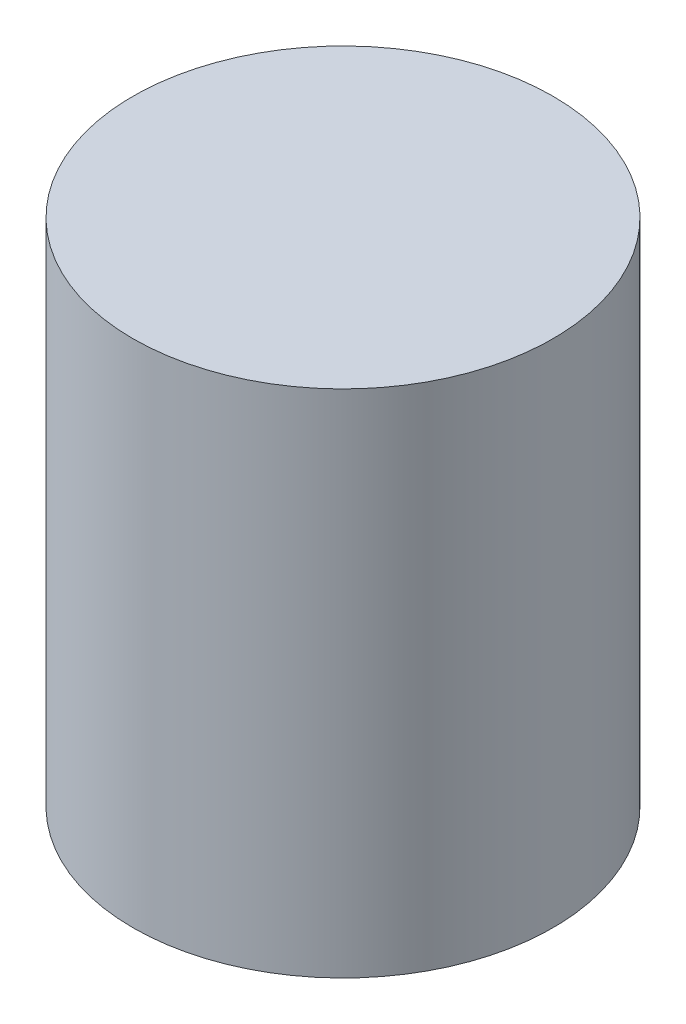
from build123d import *

# Parameters (mm, degrees)
BOSS_EXTRUDE1_DEPTH     = 15
BOSS_EXTRUDE2_START     = -30
BOSS_EXTRUDE2_OUTLINE_R = 37.05
BOSS_EXTRUDE2_DEPTH     = 90


# Read off the part's stored shape, not the designer's step: Boss-Extrude2
with BuildPart() as part:
    # Sketch1 → Boss-Extrude1 (new body)
    with BuildSketch(Plane(origin=(0, 0, 0), x_dir=(1, 0, 0), z_dir=(0, 1, 0))):
        with BuildLine():
            Line((-0.5, 37), (0.5, 37))
            Line((0.5, 37), (1.532639575, 35.967360425))
            ThreePointArc((1.532639575, 35.967360425), (1.687401449, 35.960432093), (1.842132075, 35.952837849))
            Line((1.842132075, 35.952837849), (2.966932122, 36.88424208))
            Line((2.966932122, 36.88424208), (3.962538104, 36.79060059))
            Line((3.962538104, 36.79060059), (4.893942334, 35.665800544))
            ThreePointArc((4.893942334, 35.665800544), (5.047375402, 35.644410523), (5.200715003, 35.622360442))
            Line((5.200715003, 35.622360442), (6.407790737, 36.444344114))
            Line((6.407790737, 36.444344114), (7.39025328, 36.257884059))
            Line((7.39025328, 36.257884059), (8.212236952, 35.050808325))
            ThreePointArc((8.212236952, 35.050808325), (8.362992839, 35.015144592), (8.513593861, 34.97883245))
            Line((8.513593861, 34.97883245), (9.792337458, 35.684171941))
            Line((9.792337458, 35.684171941), (10.753022645, 35.40653194))
            Line((10.753022645, 35.40653194), (11.458362136, 34.127788343))
            ThreePointArc((11.458362136, 34.127788343), (11.605115994, 34.07816431), (11.751654949, 34.027909221))
            Line((11.751654949, 34.027909221), (13.090828764, 34.610405982))
            Line((13.090828764, 34.610405982), (14.02129406, 34.244025944))
            Line((14.02129406, 34.244025944), (14.603790822, 32.904852129))
            ThreePointArc((14.603790822, 32.904852129), (14.745252972, 32.841703896), (14.886442071, 32.777947502))
            Line((14.886442071, 32.777947502), (16.274277397, 33.232482532))
            Line((16.274277397, 33.232482532), (17.166345839, 32.780582218))
            Line((17.166345839, 32.780582218), (17.620880869, 31.392746892))
            ThreePointArc((17.620880869, 31.392746892), (17.755808137, 31.316629407), (17.890406605, 31.239932002))
            Line((17.890406605, 31.239932002), (19.314707094, 31.562510829))
            Line((19.314707094, 31.562510829), (20.160539154, 31.029061556))
            Line((20.160539154, 31.029061556), (20.483117981, 29.604761066))
            ThreePointArc((20.483117981, 29.604761066), (20.610324622, 29.516343252), (20.737149602, 29.427378857))
            Line((20.737149602, 29.427378857), (22.185398452, 29.615166647))
            Line((22.185398452, 29.615166647), (22.977560925, 29.004856385))
            Line((22.977560925, 29.004856385), (23.165348716, 27.556607536))
            ThreePointArc((23.165348716, 27.556607536), (23.283716833, 27.456666412), (23.401653783, 27.356216847))
            Line((23.401653783, 27.356216847), (24.86112373, 27.407563316))
            Line((24.86112373, 27.407563316), (25.592655065, 26.725755494))
            Line((25.592655065, 26.725755494), (25.644001533, 25.266285548))
            ThreePointArc((25.644001533, 25.266285548), (25.752490903, 25.1556994), (25.860503389, 25.044647421))
            Line((25.860503389, 25.044647421), (27.318368558, 24.959101332))
            Line((27.318368558, 24.959101332), (27.982840032, 24.211787702))
            Line((27.982840032, 24.211787702), (27.897293943, 22.753922533))
            ThreePointArc((27.897293943, 22.753922533), (27.994951157, 22.633663197), (28.092089962, 22.512984732))
            Line((28.092089962, 22.512984732), (29.535538582, 22.291297869))
            Line((29.535538582, 22.291297869), (30.127110794, 21.48504585))
            Line((30.127110794, 21.48504585), (29.905423931, 20.04159723))
            ThreePointArc((29.905423931, 20.04159723), (29.991390774, 19.912721549), (30.076802238, 19.783477125))
            Line((30.076802238, 19.783477125), (31.493149231, 19.427597678))
            Line((31.493149231, 19.427597678), (32.006623424, 18.569492642))
            Line((32.006623424, 18.569492642), (31.650743977, 17.153145649))
            ThreePointArc((31.650743977, 17.153145649), (31.72426497, 17.016786187), (31.797198494, 16.880111609))
            Line((31.797198494, 16.880111609), (33.173996951, 16.39316706))
            Line((33.173996951, 16.39316706), (33.604860696, 15.490750065))
            Line((33.604860696, 15.490750065), (33.117916148, 14.113951608))
            ThreePointArc((33.117916148, 14.113951608), (33.178345185, 13.971306696), (33.238159827, 13.828403065))
            Line((33.238159827, 13.828403065), (34.563310394, 13.214672701))
            Line((34.563310394, 13.214672701), (34.907777244, 12.27587422))
            Line((34.907777244, 12.27587422), (34.294046881, 10.950723653))
            ThreePointArc((34.294046881, 10.950723653), (34.340852909, 10.80304686), (34.387023016, 10.655170017))
            Line((34.387023016, 10.655170017), (35.648880222, 9.920047323))
            Line((35.648880222, 9.920047323), (35.903922991, 8.95311755))
            Line((35.903922991, 8.95311755), (35.168800297, 7.691260344))
            ThreePointArc((35.168800297, 7.691260344), (35.201571984, 7.53984946), (35.23369181, 7.388298953))
            Line((35.23369181, 7.388298953), (36.421166409, 6.538244213))
            Line((36.421166409, 6.538244213), (36.584543771, 5.551680562))
            Line((36.584543771, 5.551680562), (35.734489031, 4.364205963))
            ThreePointArc((35.734489031, 4.364205963), (35.752938378, 4.210391591), (35.770725654, 4.056499252))
            Line((35.770725654, 4.056499252), (36.873382076, 3.098982777))
            Line((36.873382076, 3.098982777), (36.943658265, 2.101455205))
            Line((36.943658265, 2.101455205), (35.986141791, 0.998798783))
            ThreePointArc((35.986141791, 0.998798783), (35.990106664, 0.84393265), (35.993405075, 0.689050889))
            Line((35.993405075, 0.689050889), (37.001553136, -0.367512631))
            Line((37.001553136, -0.367512631), (36.978110562, -1.367237816))
            Line((36.978110562, -1.367237816), (35.921547043, -2.375385877))
            ThreePointArc((35.921547043, -2.375385877), (35.910992599, -2.529942802), (35.899773157, -2.684452878))
            Line((35.899773157, -2.684452878), (36.804553216, -3.830778324))
            Line((36.804553216, -3.830778324), (36.687597894, -4.823915502))
            Line((36.687597894, -4.823915502), (35.541272447, -5.72869556))
            ThreePointArc((35.541272447, -5.72869556), (35.516291439, -5.881585025), (35.490652743, -6.034365576))
            Line((35.490652743, -6.034365576), (36.284113559, -7.260379))
            Line((36.284113559, -7.260379), (36.074673296, -8.238200444))
            Line((36.074673296, -8.238200444), (34.848659872, -9.031661261))
            ThreePointArc((34.848659872, -9.031661261), (34.809471833, -9.181539668), (34.769639195, -9.331248052))
            Line((34.769639195, -9.331248052), (35.444807808, -10.626175205))
            Line((35.444807808, -10.626175205), (35.144723173, -11.580087785))
            Line((35.144723173, -11.580087785), (33.849796021, -12.255256398))
            ThreePointArc((33.849796021, -12.255256398), (33.796745338, -12.40080661), (33.743068809, -12.546127186))
            Line((33.743068809, -12.546127186), (34.294011811, -13.898588199))
            Line((34.294011811, -13.898588199), (33.905919958, -14.820208899))
            Line((33.905919958, -14.820208899), (32.553458945, -15.3711519))
            ThreePointArc((32.553458945, -15.3711519), (32.487011829, -15.511094818), (32.41996312, -15.650750502))
            Line((32.41996312, -15.650750502), (32.841838805, -17.048859901))
            Line((32.841838805, -17.048859901), (32.3691503, -17.930089483))
            Line((32.3691503, -17.930089483), (30.971040901, -18.351965168))
            ThreePointArc((30.971040901, -18.351965168), (30.891781292, -18.485070967), (30.81194963, -18.61783446))
            Line((30.81194963, -18.61783446), (31.101050539, -20.049305609))
            Line((31.101050539, -20.049305609), (30.547919385, -20.882399797))
            Line((30.547919385, -20.882399797), (29.116448236, -21.171500705))
            ThreePointArc((29.116448236, -21.171500705), (29.02507267, -21.296599647), (28.933159619, -21.42130422))
            Line((28.933159619, -21.42130422), (29.086945122, -22.873557298))
            Line((29.086945122, -22.873557298), (28.458232256, -23.65119483))
            Line((28.458232256, -23.65119483), (27.005979177, -23.804980333))
            ThreePointArc((27.005979177, -23.804980333), (26.903290666, -23.920973044), (26.80010396, -24.036522787))
            Line((26.80010396, -24.036522787), (26.817222586, -25.496795343))
            Line((26.817222586, -25.496795343), (26.118453158, -26.212142313))
            Line((26.118453158, -26.212142313), (24.658180603, -26.229260938))
            ThreePointArc((24.658180603, -26.229260938), (24.545081576, -26.335128069), (24.431528025, -26.440507529))
            Line((24.431528025, -26.440507529), (24.311829334, -27.895966634))
            Line((24.311829334, -27.895966634), (23.549144156, -28.542736546))
            Line((23.549144156, -28.542736546), (22.09368505, -28.423037855))
            ThreePointArc((22.09368505, -28.423037855), (21.971169427, -28.517849043), (21.848246942, -28.612132139))
            Line((21.848246942, -28.612132139), (21.592782851, -30.049987167))
            Line((21.592782851, -30.049987167), (20.772884427, -30.622496185))
            Line((20.772884427, -30.622496185), (19.335029399, -30.367032093))
            ThreePointArc((19.335029399, -30.367032093), (19.20417385, -30.449954133), (19.07296268, -30.532312303))
            Line((19.07296268, -30.532312303), (18.683978216, -31.939927333))
            Line((18.683978216, -31.939927333), (17.814071844, -32.433144225))
            Line((17.814071844, -32.433144225), (16.406456814, -32.044159761))
            ThreePointArc((16.406456814, -32.044159761), (16.268411304, -32.114463932), (16.130064536, -32.184173409))
            Line((16.130064536, -32.184173409), (15.610978109, -33.549178268))
            Line((15.610978109, -33.549178268), (14.698708556, -33.958768629))
            Line((14.698708556, -33.958768629), (13.333703697, -33.439682201))
            ThreePointArc((13.333703697, -33.439682201), (13.189681374, -33.496750667), (13.045414805, -33.553198842))
            Line((13.045414805, -33.553198842), (12.400788165, -34.863597819))
            Line((12.400788165, -34.863597819), (11.454172489, -35.185962152))
            Line((11.454172489, -35.185962152), (10.143773513, -34.541335512))
            ThreePointArc((10.143773513, -34.541335512), (9.99504005, -34.584666753), (9.8461215, -34.627357557))
            Line((9.8461215, -34.627357557), (9.081619648, -35.871634819))
            Line((9.081619648, -35.871634819), (8.108976743, -36.103940175))
            Line((8.108976743, -36.103940175), (6.864699482, -35.339438324))
            ThreePointArc((6.864699482, -35.339438324), (6.712561955, -35.368651544), (6.560300125, -35.397209809))
            Line((6.560300125, -35.397209809), (5.682641532, -36.564430602))
            Line((5.682641532, -36.564430602), (4.692519017, -36.704635474))
            Line((4.692519017, -36.704635474), (3.525298225, -35.826976881))
            ThreePointArc((3.525298225, -35.826976881), (3.371093623, -35.841815353), (3.216826596, -35.855990108))
            Line((3.216826596, -35.855990108), (2.233724157, -36.935896854))
            Line((2.233724157, -36.935896854), (1.234823266, -36.982769116))
            Line((1.234823266, -36.982769116), (0.15491652, -35.999666677))
            ThreePointArc((0.15491652, -35.999666677), (0, -36), (-0.15491652, -35.999666677))
            Line((-0.15491652, -35.999666677), (-1.234823266, -36.982769116))
            Line((-1.234823266, -36.982769116), (-2.233724157, -36.935896854))
            Line((-2.233724157, -36.935896854), (-3.216826596, -35.855990108))
            ThreePointArc((-3.216826596, -35.855990108), (-3.371093623, -35.841815353), (-3.525298225, -35.826976881))
            Line((-3.525298225, -35.826976881), (-4.692519017, -36.704635474))
            Line((-4.692519017, -36.704635474), (-5.682641532, -36.564430602))
            Line((-5.682641532, -36.564430602), (-6.560300125, -35.397209809))
            ThreePointArc((-6.560300125, -35.397209809), (-6.712561954, -35.368651544), (-6.864699482, -35.339438324))
            Line((-6.864699482, -35.339438324), (-8.108976743, -36.103940175))
            Line((-8.108976743, -36.103940175), (-9.081619648, -35.871634819))
            Line((-9.081619648, -35.871634819), (-9.8461215, -34.627357557))
            ThreePointArc((-9.8461215, -34.627357557), (-9.99504005, -34.584666753), (-10.143773513, -34.541335512))
            Line((-10.143773513, -34.541335512), (-11.454172489, -35.185962152))
            Line((-11.454172489, -35.185962152), (-12.400788165, -34.863597819))
            Line((-12.400788165, -34.863597819), (-13.045414805, -33.553198842))
            ThreePointArc((-13.045414805, -33.553198842), (-13.189681374, -33.496750667), (-13.333703697, -33.439682201))
            Line((-13.333703697, -33.439682201), (-14.698708556, -33.958768629))
            Line((-14.698708556, -33.958768629), (-15.610978109, -33.549178268))
            Line((-15.610978109, -33.549178268), (-16.130064536, -32.18417341))
            ThreePointArc((-16.130064536, -32.18417341), (-16.268411304, -32.114463932), (-16.406456814, -32.044159761))
            Line((-16.406456814, -32.044159761), (-17.814071844, -32.433144225))
            Line((-17.814071844, -32.433144225), (-18.683978216, -31.939927333))
            Line((-18.683978216, -31.939927333), (-19.07296268, -30.532312303))
            ThreePointArc((-19.07296268, -30.532312303), (-19.20417385, -30.449954133), (-19.335029399, -30.367032093))
            Line((-19.335029399, -30.367032093), (-20.772884427, -30.622496185))
            Line((-20.772884427, -30.622496185), (-21.592782851, -30.049987167))
            Line((-21.592782851, -30.049987167), (-21.848246942, -28.612132139))
            ThreePointArc((-21.848246942, -28.612132139), (-21.971169427, -28.517849043), (-22.09368505, -28.423037855))
            Line((-22.09368505, -28.423037855), (-23.549144156, -28.542736546))
            Line((-23.549144156, -28.542736546), (-24.311829334, -27.895966634))
            Line((-24.311829334, -27.895966634), (-24.431528025, -26.440507529))
            ThreePointArc((-24.431528025, -26.440507529), (-24.545081576, -26.33512807), (-24.658180603, -26.229260938))
            Line((-24.658180603, -26.229260938), (-26.118453158, -26.212142313))
            Line((-26.118453158, -26.212142313), (-26.817222586, -25.496795343))
            Line((-26.817222586, -25.496795343), (-26.80010396, -24.036522787))
            ThreePointArc((-26.80010396, -24.036522787), (-26.903290666, -23.920973044), (-27.005979177, -23.804980333))
            Line((-27.005979177, -23.804980333), (-28.458232256, -23.65119483))
            Line((-28.458232256, -23.65119483), (-29.086945122, -22.873557298))
            Line((-29.086945122, -22.873557298), (-28.933159619, -21.42130422))
            ThreePointArc((-28.933159619, -21.42130422), (-29.02507267, -21.296599647), (-29.116448236, -21.171500705))
            Line((-29.116448236, -21.171500705), (-30.547919385, -20.882399797))
            Line((-30.547919385, -20.882399797), (-31.101050539, -20.049305609))
            Line((-31.101050539, -20.049305609), (-30.81194963, -18.61783446))
            ThreePointArc((-30.81194963, -18.61783446), (-30.891781291, -18.485070967), (-30.971040901, -18.351965168))
            Line((-30.971040901, -18.351965168), (-32.3691503, -17.930089483))
            Line((-32.3691503, -17.930089483), (-32.841838805, -17.048859901))
            Line((-32.841838805, -17.048859901), (-32.41996312, -15.650750502))
            ThreePointArc((-32.41996312, -15.650750502), (-32.487011829, -15.511094818), (-32.553458945, -15.3711519))
            Line((-32.553458945, -15.3711519), (-33.905919958, -14.820208899))
            Line((-33.905919958, -14.820208899), (-34.294011811, -13.898588199))
            Line((-34.294011811, -13.898588199), (-33.743068809, -12.546127186))
            ThreePointArc((-33.743068809, -12.546127186), (-33.796745338, -12.40080661), (-33.84979602, -12.255256398))
            Line((-33.84979602, -12.255256398), (-35.144723173, -11.580087785))
            Line((-35.144723173, -11.580087785), (-35.444807808, -10.626175205))
            Line((-35.444807808, -10.626175205), (-34.769639195, -9.331248052))
            ThreePointArc((-34.769639195, -9.331248052), (-34.809471833, -9.181539668), (-34.848659872, -9.031661261))
            Line((-34.848659872, -9.031661261), (-36.074673296, -8.238200444))
            Line((-36.074673296, -8.238200444), (-36.284113559, -7.260379))
            Line((-36.284113559, -7.260379), (-35.490652743, -6.034365576))
            ThreePointArc((-35.490652743, -6.034365576), (-35.516291439, -5.881585026), (-35.541272447, -5.72869556))
            Line((-35.541272447, -5.72869556), (-36.687597894, -4.823915502))
            Line((-36.687597894, -4.823915502), (-36.804553216, -3.830778324))
            Line((-36.804553216, -3.830778324), (-35.899773157, -2.684452878))
            ThreePointArc((-35.899773157, -2.684452878), (-35.910992599, -2.529942802), (-35.921547043, -2.375385877))
            Line((-35.921547043, -2.375385877), (-36.978110562, -1.367237816))
            Line((-36.978110562, -1.367237816), (-37.001553136, -0.367512631))
            Line((-37.001553136, -0.367512631), (-35.993405075, 0.689050889))
            ThreePointArc((-35.993405075, 0.689050889), (-35.990106664, 0.84393265), (-35.986141791, 0.998798783))
            Line((-35.986141791, 0.998798783), (-36.943658265, 2.101455205))
            Line((-36.943658265, 2.101455205), (-36.873382076, 3.098982777))
            Line((-36.873382076, 3.098982777), (-35.770725654, 4.056499251))
            ThreePointArc((-35.770725654, 4.056499251), (-35.752938378, 4.210391591), (-35.734489031, 4.364205963))
            Line((-35.734489031, 4.364205963), (-36.584543771, 5.551680562))
            Line((-36.584543771, 5.551680562), (-36.421166409, 6.538244213))
            Line((-36.421166409, 6.538244213), (-35.23369181, 7.388298953))
            ThreePointArc((-35.23369181, 7.388298953), (-35.201571984, 7.53984946), (-35.168800297, 7.691260344))
            Line((-35.168800297, 7.691260344), (-35.903922991, 8.95311755))
            Line((-35.903922991, 8.95311755), (-35.648880222, 9.920047323))
            Line((-35.648880222, 9.920047323), (-34.387023016, 10.655170017))
            ThreePointArc((-34.387023016, 10.655170017), (-34.340852909, 10.80304686), (-34.294046881, 10.950723653))
            Line((-34.294046881, 10.950723653), (-34.907777244, 12.27587422))
            Line((-34.907777244, 12.27587422), (-34.563310394, 13.214672701))
            Line((-34.563310394, 13.214672701), (-33.238159827, 13.828403065))
            ThreePointArc((-33.238159827, 13.828403065), (-33.178345185, 13.971306696), (-33.117916148, 14.113951608))
            Line((-33.117916148, 14.113951608), (-33.604860696, 15.490750065))
            Line((-33.604860696, 15.490750065), (-33.173996951, 16.39316706))
            Line((-33.173996951, 16.39316706), (-31.797198494, 16.880111608))
            ThreePointArc((-31.797198494, 16.880111608), (-31.72426497, 17.016786187), (-31.650743978, 17.153145649))
            Line((-31.650743978, 17.153145649), (-32.006623424, 18.569492642))
            Line((-32.006623424, 18.569492642), (-31.493149231, 19.427597678))
            Line((-31.493149231, 19.427597678), (-30.076802238, 19.783477125))
            ThreePointArc((-30.076802238, 19.783477125), (-29.991390774, 19.912721548), (-29.905423931, 20.04159723))
            Line((-29.905423931, 20.04159723), (-30.127110795, 21.48504585))
            Line((-30.127110795, 21.48504585), (-29.535538582, 22.291297869))
            Line((-29.535538582, 22.291297869), (-28.092089962, 22.512984732))
            ThreePointArc((-28.092089962, 22.512984732), (-27.994951157, 22.633663197), (-27.897293943, 22.753922533))
            Line((-27.897293943, 22.753922533), (-27.982840032, 24.211787702))
            Line((-27.982840032, 24.211787702), (-27.318368559, 24.959101332))
            Line((-27.318368559, 24.959101332), (-25.86050339, 25.044647421))
            ThreePointArc((-25.86050339, 25.044647421), (-25.752490903, 25.1556994), (-25.644001533, 25.266285548))
            Line((-25.644001533, 25.266285548), (-25.592655065, 26.725755494))
            Line((-25.592655065, 26.725755494), (-24.86112373, 27.407563316))
            Line((-24.86112373, 27.407563316), (-23.401653783, 27.356216847))
            ThreePointArc((-23.401653783, 27.356216847), (-23.283716833, 27.456666412), (-23.165348716, 27.556607536))
            Line((-23.165348716, 27.556607536), (-22.977560925, 29.004856385))
            Line((-22.977560925, 29.004856385), (-22.185398452, 29.615166647))
            Line((-22.185398452, 29.615166647), (-20.737149602, 29.427378857))
            ThreePointArc((-20.737149602, 29.427378857), (-20.610324622, 29.516343252), (-20.483117981, 29.604761066))
            Line((-20.483117981, 29.604761066), (-20.160539154, 31.029061556))
            Line((-20.160539154, 31.029061556), (-19.314707094, 31.562510829))
            Line((-19.314707094, 31.562510829), (-17.890406605, 31.239932002))
            ThreePointArc((-17.890406605, 31.239932002), (-17.755808137, 31.316629407), (-17.620880869, 31.392746892))
            Line((-17.620880869, 31.392746892), (-17.166345839, 32.780582218))
            Line((-17.166345839, 32.780582218), (-16.274277397, 33.232482532))
            Line((-16.274277397, 33.232482532), (-14.886442071, 32.777947502))
            ThreePointArc((-14.886442071, 32.777947502), (-14.745252972, 32.841703896), (-14.603790822, 32.904852129))
            Line((-14.603790822, 32.904852129), (-14.02129406, 34.244025944))
            Line((-14.02129406, 34.244025944), (-13.090828764, 34.610405982))
            Line((-13.090828764, 34.610405982), (-11.751654949, 34.027909221))
            ThreePointArc((-11.751654949, 34.027909221), (-11.605115994, 34.07816431), (-11.458362136, 34.127788343))
            Line((-11.458362136, 34.127788343), (-10.753022645, 35.40653194))
            Line((-10.753022645, 35.40653194), (-9.792337458, 35.684171941))
            Line((-9.792337458, 35.684171941), (-8.513593861, 34.97883245))
            ThreePointArc((-8.513593861, 34.97883245), (-8.362992839, 35.015144592), (-8.212236952, 35.050808325))
            Line((-8.212236952, 35.050808325), (-7.39025328, 36.257884059))
            Line((-7.39025328, 36.257884059), (-6.407790737, 36.444344114))
            Line((-6.407790737, 36.444344114), (-5.200715003, 35.622360442))
            ThreePointArc((-5.200715003, 35.622360442), (-5.047375402, 35.644410523), (-4.893942334, 35.665800544))
            Line((-4.893942334, 35.665800544), (-3.962538104, 36.79060059))
            Line((-3.962538104, 36.79060059), (-2.966932122, 36.88424208))
            Line((-2.966932122, 36.88424208), (-1.842132076, 35.952837849))
            ThreePointArc((-1.842132076, 35.952837849), (-1.687401449, 35.960432093), (-1.532639575, 35.967360425))
            Line((-1.532639575, 35.967360425), (-0.5, 37))
        make_face()
    boss_extrude1 = extrude(amount=BOSS_EXTRUDE1_DEPTH)

    # Mirror1: Boss-Extrude1 across plane
    add(boss_extrude1.mirror(Plane.ZX.offset(15)))


with BuildPart() as body_2:
    # Boss-Extrude2 outline → Boss-Extrude2 (new body)
    with BuildSketch(Plane(origin=(0, 0, 0), x_dir=(1, 0, 0), z_dir=(0, 1, 0)).offset(BOSS_EXTRUDE2_START)):
        Circle(BOSS_EXTRUDE2_OUTLINE_R)
    extrude(amount=BOSS_EXTRUDE2_DEPTH)

    # Combine1: cut part
    add(part.part, mode=Mode.SUBTRACT)


solid = body_2.part
